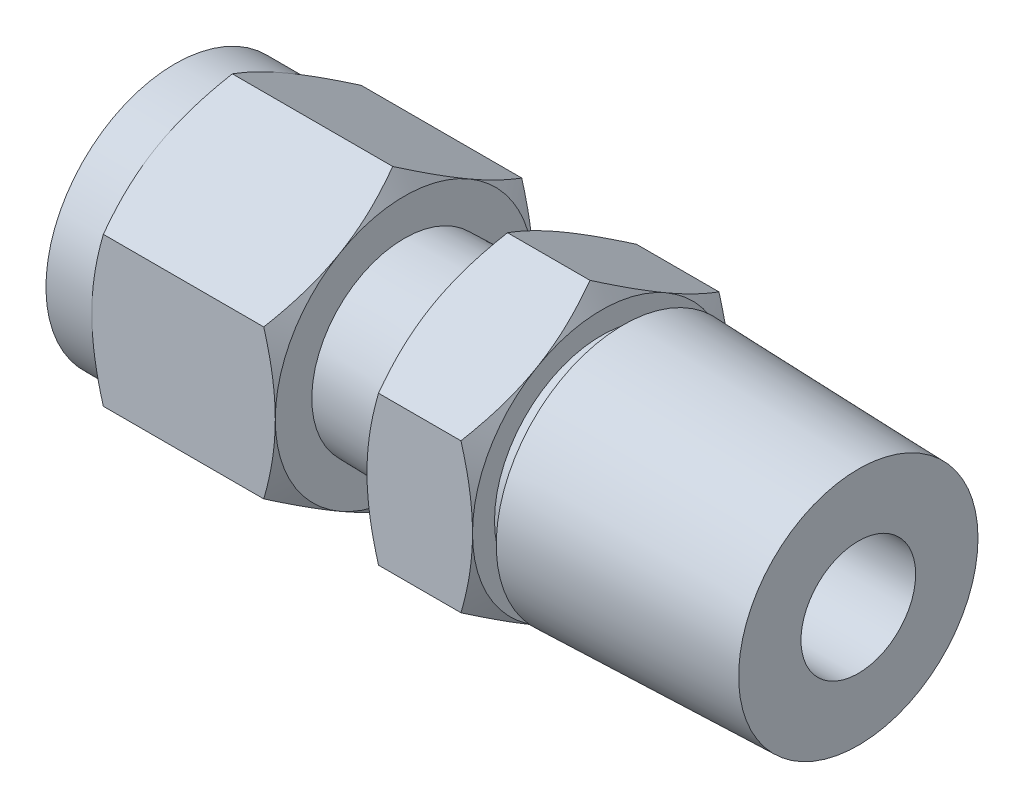
from build123d import *

# Parameters (mm, degrees)
EXTRUDE6_START     = 5.842
SKETCH16_R         = 2.921
EXTRUDE6_DEPTH     = 5.842
SKETCH17_OUTSIDE_W = 44.214
SKETCH17_OUTSIDE_H = 46.424
SKETCH17_OUTSIDE_R = 7.14375
EXTRUDE7_DEPTH     = 6.35
EXTRUDE7_DRAFT     = -60
SKETCH18_OUTSIDE_W = 44.214
SKETCH18_OUTSIDE_H = 46.424
SKETCH18_OUTSIDE_R = 7.14375
EXTRUDE8_DEPTH     = 6.35
EXTRUDE8_DRAFT     = -60
EXTRUDE1_START     = -10.16
SKETCH6_R          = 2.921
EXTRUDE1_DEPTH     = 10.16
SKETCH8_OUTSIDE_W  = 29.868
SKETCH8_OUTSIDE_H  = 32.078
SKETCH8_OUTSIDE_R  = 7.14375
EXTRUDE2_DEPTH     = 1.524
EXTRUDE2_DRAFT     = -60
SKETCH9_OUTSIDE_W  = 46.586
SKETCH9_OUTSIDE_H  = 48.796
SKETCH9_OUTSIDE_R  = 7.14375
EXTRUDE3_DEPTH     = 6.35
EXTRUDE3_DRAFT     = -60
SKETCH15_R         = 3.175
EXTRUDE5_DEPTH     = 15.24


with BuildPart() as part:
    # Sketch5 → Revolve1 (revolve)
    with BuildSketch(Plane.XY):
        Polygon((-7.38378, -3.175), (-7.38378, -2.921), (-14.224, -2.921), (-14.224, -5.92455), (-13.660154017, -5.92455), (-13.02004, -7.03326), (0, -6.628638049), (0, -3.175), align=None)
    revolve(axis=Axis((0, 0, 0), (-1, 0, 0)))

    # Sketch16 → Extrude6 (add)
    with BuildSketch(Plane.ZY.offset(14.224).offset(EXTRUDE6_START)):
        Polygon((0, 8.248891971), (-7.14375, 4.124445986), (-7.14375, -4.124445986), (0, -8.248891971), (7.14375, -4.124445986), (7.14375, 4.124445986), align=None)
        Circle(SKETCH16_R, mode=Mode.SUBTRACT)
    extrude(amount=-EXTRUDE6_DEPTH)


with BuildPart() as extrude7_tool:
    # Sketch17 outside → Extrude7 (with draft: the straight prism first)
    with BuildSketch(Plane.ZY.offset(20.066)):
        Rectangle(SKETCH17_OUTSIDE_W, SKETCH17_OUTSIDE_H)
        Circle(SKETCH17_OUTSIDE_R, mode=Mode.SUBTRACT)
    extrude(amount=-EXTRUDE7_DEPTH)
    # Extrude7: the draft: its side faces are tilted about the plane it starts from
    extrude7_sides = [extrude7_tool.faces().sort_by_distance(p)[0] for p in [
        (-16.891, -23.212, 0),
        (-16.891, 0, 22.107),
        (-16.891, 23.212, 0),
        (-16.891, 0, -22.107),
        (-16.891, 0, -7.14375),
    ]]
    draft(extrude7_sides, Plane.ZY.offset(20.066), EXTRUDE7_DRAFT)


with BuildPart() as part_1:
    add(part.part)

    # Extrude7: cut by extrude7_tool
    add(extrude7_tool.part, mode=Mode.SUBTRACT)


with BuildPart() as extrude8_tool:
    # Sketch18 outside → Extrude8 (with draft: the straight prism first)
    with BuildSketch(Plane(origin=(-14.224, 0, 0), x_dir=(0, 0, -1), z_dir=(1, 0, 0))):
        Rectangle(SKETCH18_OUTSIDE_W, SKETCH18_OUTSIDE_H)
        Circle(SKETCH18_OUTSIDE_R, mode=Mode.SUBTRACT)
    extrude(amount=-EXTRUDE8_DEPTH)
    # Extrude8: the draft: its side faces are tilted about the plane it starts from
    extrude8_sides = [extrude8_tool.faces().sort_by_distance(p)[0] for p in [
        (-17.399, -23.212, 0),
        (-17.399, 0, -22.107),
        (-17.399, 23.212, 0),
        (-17.399, 0, 22.107),
        (-17.399, 0, 7.14375),
    ]]
    draft(extrude8_sides, Plane(origin=(-14.224, 0, 0), x_dir=(0, 0, -1), z_dir=(1, 0, 0)), EXTRUDE8_DRAFT)


with BuildPart() as part_2:
    add(part_1.part)

    # Extrude8: cut by extrude8_tool
    add(extrude8_tool.part, mode=Mode.SUBTRACT)



with BuildPart() as body_2:
    # Sketch6 → Extrude1 (new body)
    with BuildSketch(Plane(origin=(-25.146, 0, 0), x_dir=(0, 0, -1), z_dir=(1, 0, 0)).offset(EXTRUDE1_START)):
        Polygon((0, -8.248891971), (7.14375, -4.124445986), (7.14375, 4.124445986), (0, 8.248891971), (-7.14375, 4.124445986), (-7.14375, -4.124445986), align=None)
        Circle(SKETCH6_R, mode=Mode.SUBTRACT)
    extrude(amount=EXTRUDE1_DEPTH)


with BuildPart() as extrude2_tool:
    # Sketch8 outside → Extrude2 (with draft: the straight prism first)
    with BuildSketch(Plane.ZY.offset(35.306)):
        Rectangle(SKETCH8_OUTSIDE_W, SKETCH8_OUTSIDE_H)
        Circle(SKETCH8_OUTSIDE_R, mode=Mode.SUBTRACT)
    extrude(amount=-EXTRUDE2_DEPTH)
    # Extrude2: the draft: its side faces are tilted about the plane it starts from
    extrude2_sides = [extrude2_tool.faces().sort_by_distance(p)[0] for p in [
        (-34.544, -16.039, 0),
        (-34.544, 0, 14.934),
        (-34.544, 16.039, 0),
        (-34.544, 0, -14.934),
        (-34.544, 0, -7.14375),
    ]]
    draft(extrude2_sides, Plane.ZY.offset(35.306), EXTRUDE2_DRAFT)


with BuildPart() as body_2_1:
    add(body_2.part)

    # Extrude2: cut by extrude2_tool
    add(extrude2_tool.part, mode=Mode.SUBTRACT)


with BuildPart() as extrude3_tool:
    # Sketch9 outside → Extrude3 (with draft: the straight prism first)
    with BuildSketch(Plane(origin=(-25.146, 0, 0), x_dir=(0, 0, -1), z_dir=(1, 0, 0))):
        Rectangle(SKETCH9_OUTSIDE_W, SKETCH9_OUTSIDE_H)
        Circle(SKETCH9_OUTSIDE_R, mode=Mode.SUBTRACT)
    extrude(amount=-EXTRUDE3_DEPTH)
    # Extrude3: the draft: its side faces are tilted about the plane it starts from
    extrude3_sides = [extrude3_tool.faces().sort_by_distance(p)[0] for p in [
        (-28.321, -24.398, 0),
        (-28.321, 0, -23.293),
        (-28.321, 24.398, 0),
        (-28.321, 0, 23.293),
        (-28.321, 0, 7.14375),
    ]]
    draft(extrude3_sides, Plane(origin=(-25.146, 0, 0), x_dir=(0, 0, -1), z_dir=(1, 0, 0)), EXTRUDE3_DRAFT)


with BuildPart() as body_2_2:
    add(body_2_1.part)

    # Extrude3: cut by extrude3_tool
    add(extrude3_tool.part, mode=Mode.SUBTRACT)


with BuildPart() as part_3:
    add(part_2.part)

    add(body_2_2.part)  # Revolve2 merges body 2
    # Sketch11 → Revolve2 (revolve)
    with BuildSketch(Plane.XY):
        Polygon((-20.954977322, 4.49834), (-21.38172, 5.23748), (-30.226, 4.962627555), (-30.226, 7.14375), (-37.846, 7.14375), (-37.846, 2.921), (-14.224, 2.921), (-14.224, 4.49834), align=None)
    revolve(axis=Axis((0, 0, 0), (-1, 0, 0)))

    # Sketch15 → Extrude5 (cut)
    with BuildSketch(Plane.ZY.offset(37.846)):
        Circle(SKETCH15_R)
    extrude(amount=-EXTRUDE5_DEPTH, mode=Mode.SUBTRACT)


solid = part_3.part
